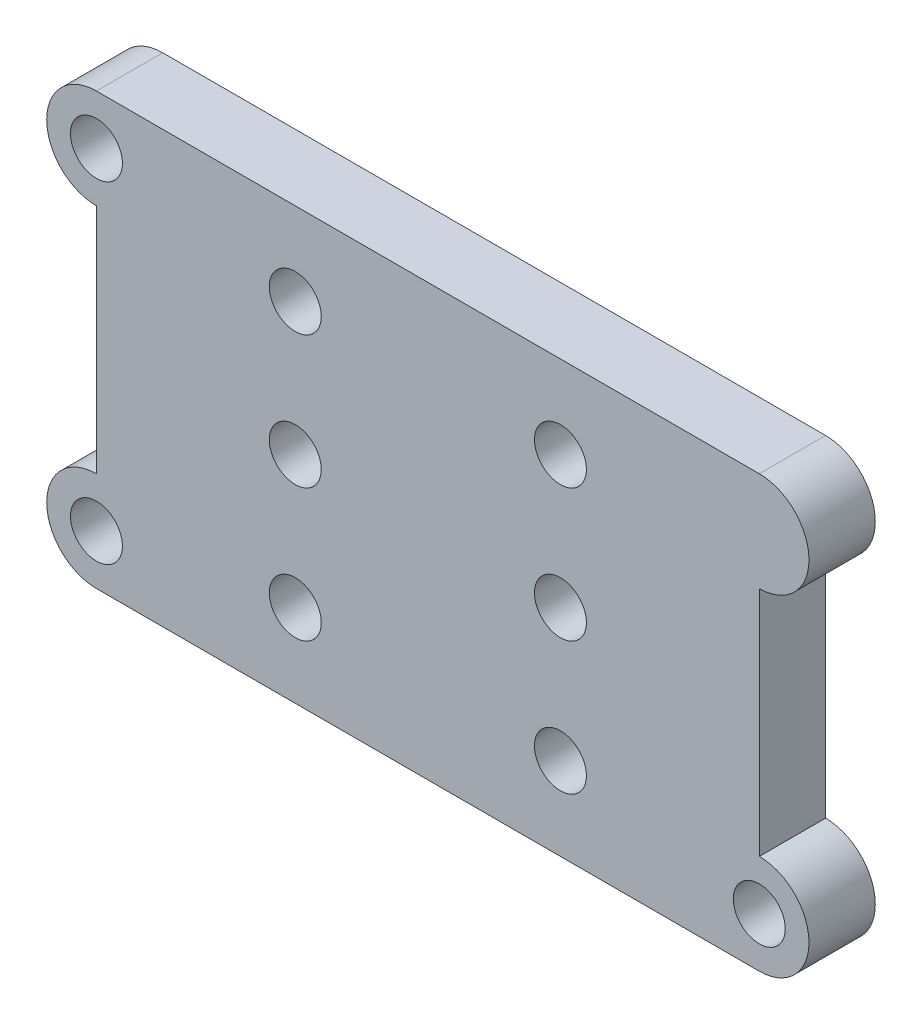
from build123d import *

# Parameters (mm, degrees)
SKETCH1_R           = 2.4892
BOSS_EXTRUDE1_DEPTH = 6.35


with BuildPart() as part:
    # Sketch1 → Boss-Extrude1 (new body)
    with BuildSketch(Plane.XY):
        with BuildLine():
            Line((63.5, 9.525), (63.5, 31.75))
            ThreePointArc((63.5, 31.75), (68.2625, 36.5125), (63.5, 41.275))
            Line((63.5, 41.275), (0, 41.275))
            ThreePointArc((0, 41.275), (-4.7625, 36.5125), (0, 31.75))
            Line((0, 31.75), (0, 9.525))
            ThreePointArc((0, 9.525), (-4.7625, 4.7625), (0, 0))
            Line((0, 0), (63.5, 0))
            ThreePointArc((63.5, 0), (68.2625, 4.7625), (63.5, 9.525))
        make_face()
        with Locations((19.05, 7.9375)):
            Circle(SKETCH1_R, mode=Mode.SUBTRACT)
        with Locations((44.45, 7.9375)):
            Circle(SKETCH1_R, mode=Mode.SUBTRACT)
        with Locations((19.05, 20.6375)):
            Circle(SKETCH1_R, mode=Mode.SUBTRACT)
        with Locations((19.05, 33.3375)):
            Circle(SKETCH1_R, mode=Mode.SUBTRACT)
        with Locations((44.45, 20.6375)):
            Circle(SKETCH1_R, mode=Mode.SUBTRACT)
        with Locations((44.45, 33.3375)):
            Circle(SKETCH1_R, mode=Mode.SUBTRACT)
        with Locations((63.5, 4.7625)):
            Circle(SKETCH1_R, mode=Mode.SUBTRACT)
        with Locations((0, 4.7625)):
            Circle(SKETCH1_R, mode=Mode.SUBTRACT)
        with Locations((0, 36.5125)):
            Circle(SKETCH1_R, mode=Mode.SUBTRACT)
    extrude(amount=BOSS_EXTRUDE1_DEPTH)


solid = part.part
